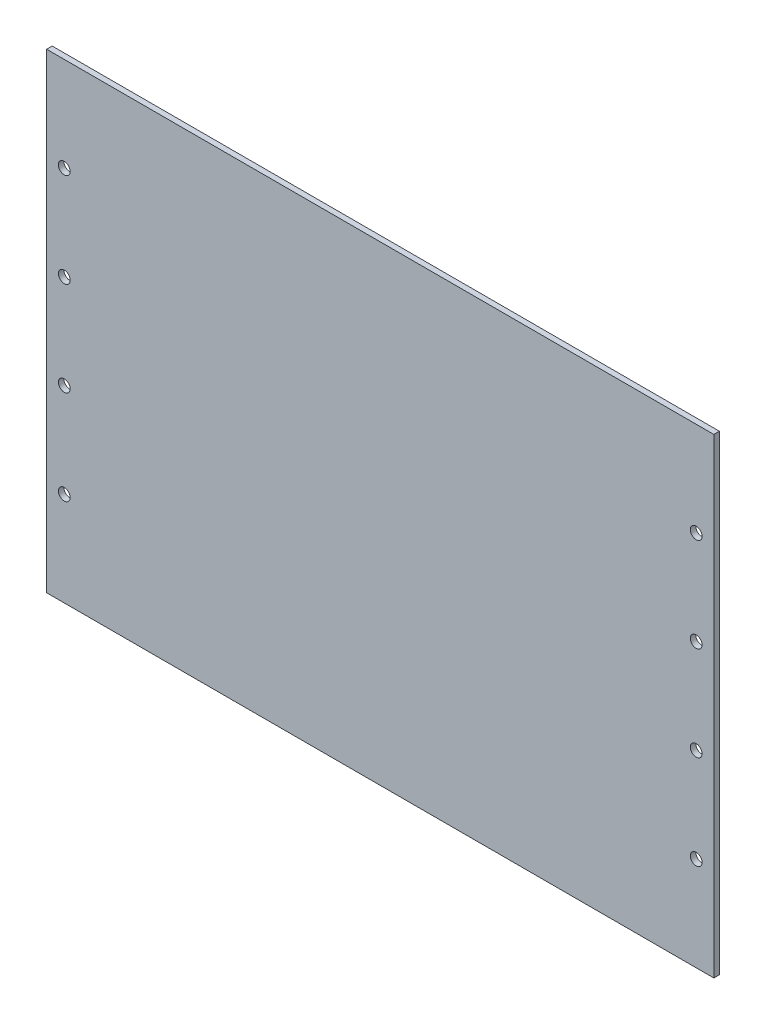
from build123d import *

# Parameters (mm, degrees)
SKETCH1_W           = 180
SKETCH1_H           = 127
SKETCH1_R           = 1.5875
BOSS_EXTRUDE1_DEPTH = 1.5


with BuildPart() as part:
    # Sketch1 → Boss-Extrude1 (new body)
    with BuildSketch(Plane.XY):
        Rectangle(SKETCH1_W, SKETCH1_H)
        with Locations((-85.2375, -38.1)):
            Circle(SKETCH1_R, mode=Mode.SUBTRACT)
        with Locations((-85.2375, -12.7)):
            Circle(SKETCH1_R, mode=Mode.SUBTRACT)
        with Locations((-85.2375, 12.7)):
            Circle(SKETCH1_R, mode=Mode.SUBTRACT)
        with Locations((-85.2375, 38.1)):
            Circle(SKETCH1_R, mode=Mode.SUBTRACT)
        with Locations((85.2375, 38.1)):
            Circle(SKETCH1_R, mode=Mode.SUBTRACT)
        with Locations((85.2375, 12.7)):
            Circle(SKETCH1_R, mode=Mode.SUBTRACT)
        with Locations((85.2375, -12.7)):
            Circle(SKETCH1_R, mode=Mode.SUBTRACT)
        with Locations((85.2375, -38.1)):
            Circle(SKETCH1_R, mode=Mode.SUBTRACT)
    extrude(amount=BOSS_EXTRUDE1_DEPTH)


solid = part.part
